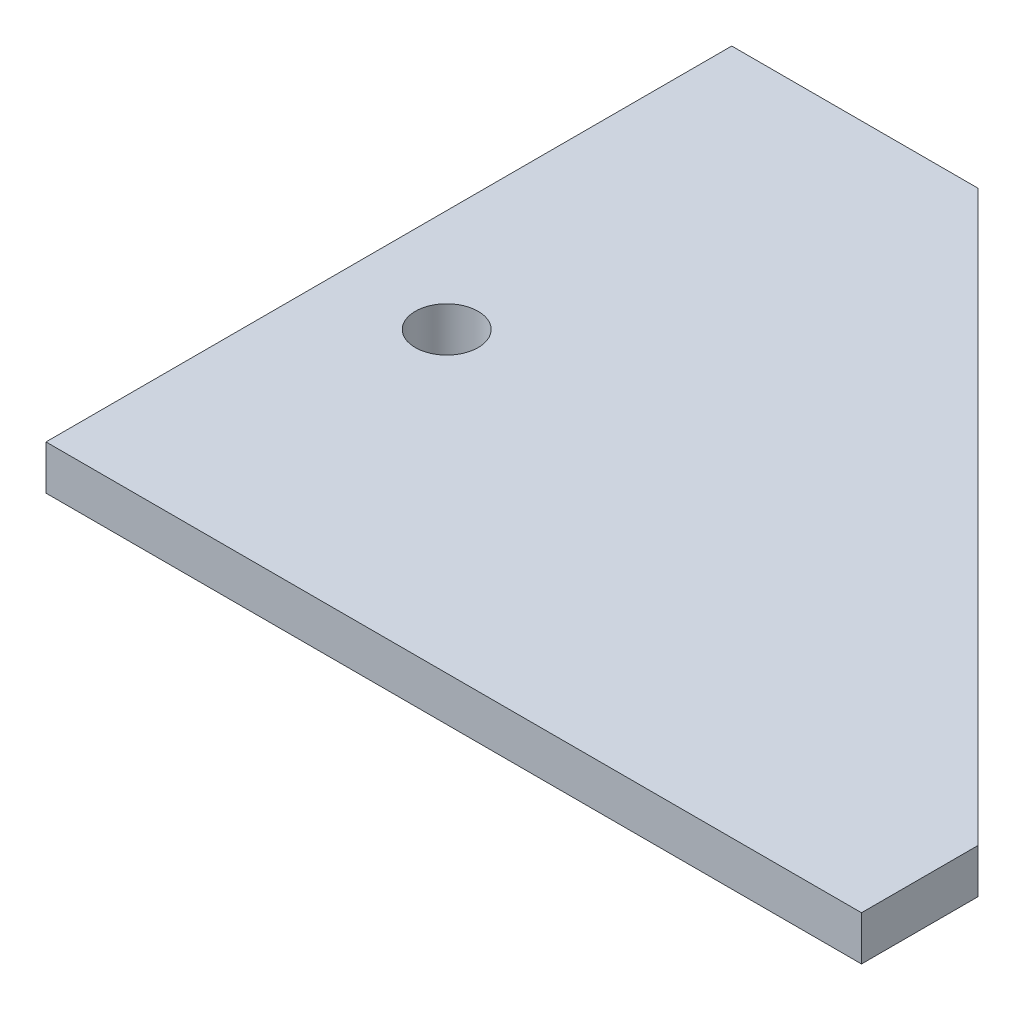
from build123d import *

# Parameters (mm, degrees)
BOSS_EXTRUDE1_DEPTH = 38.1
SKETCH2_R           = 27
CUT_EXTRUDE1_DEPTH  = 459.875847071


with BuildPart() as part:
    # Sketch1 → Boss-Extrude1 (new body)
    with BuildSketch(Plane(origin=(0, 0, 0), x_dir=(1, 0, 0), z_dir=(0, 1, 0))):
        Polygon((-138.61, 294.305), (350, -194.305), (350, -294.305), (-350, -294.305), (-350, 294.305), align=None)
    extrude(amount=BOSS_EXTRUDE1_DEPTH)

    # Sketch2 → Cut-Extrude1 (cut, through all)
    with BuildSketch(Plane(origin=(0, 0, 0), x_dir=(-1, 0, 0), z_dir=(0, -1, 0))):
        with Locations((261.63290744, -38.711846895)):
            Circle(SKETCH2_R)
    extrude(amount=-CUT_EXTRUDE1_DEPTH, mode=Mode.SUBTRACT)


solid = part.part
